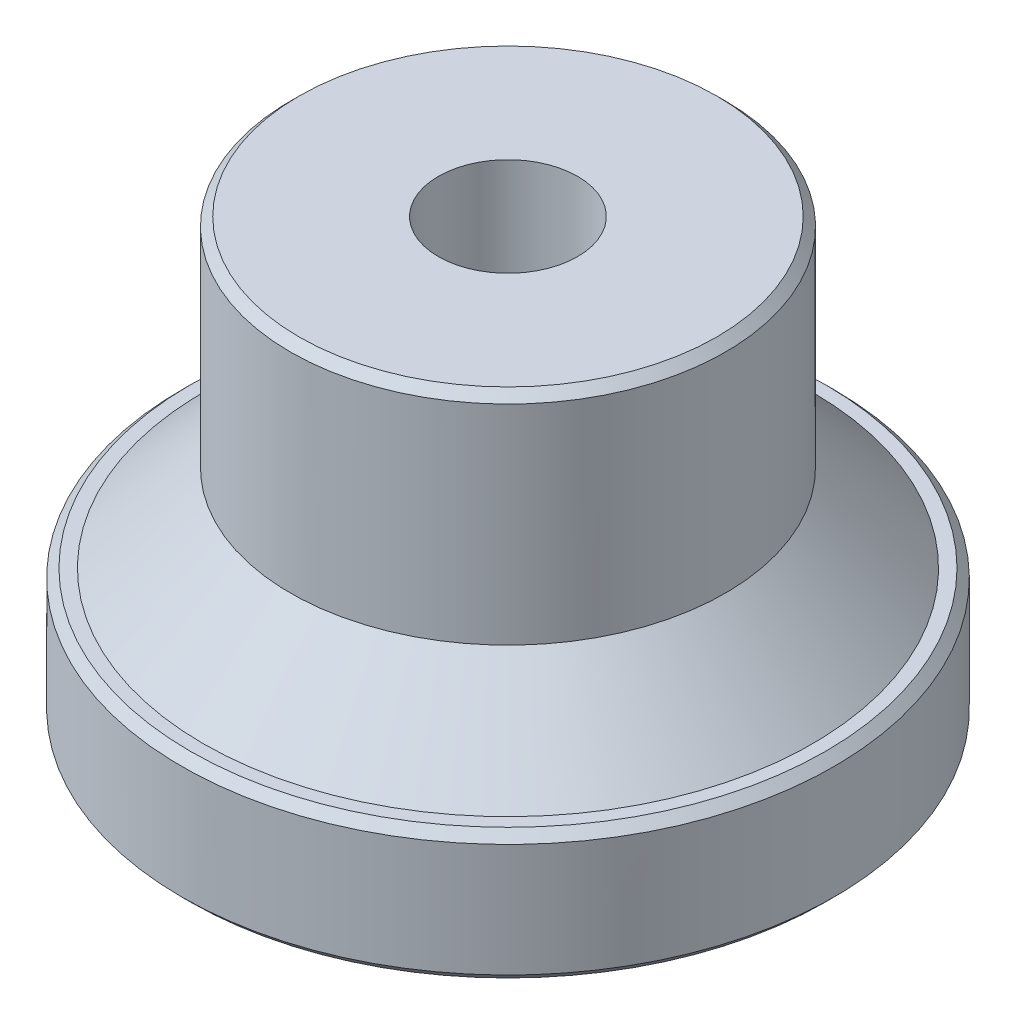
from build123d import *

# Parameters (mm, degrees)
SKETCH_1_R          = 5
SKETCH_1_R_2        = 1.6
EXTRUDE_1_DEPTH     = 10
SKETCH_2_R          = 3
CUT_EXTRUDE_1_DEPTH = 4
CHAMFER_1_SIZE      = 0.2
SKETCH_4_R          = 7.5
SKETCH_4_R_2        = 5
EXTRUDE_2_DEPTH     = 3
CHAMFER_2_SIZE      = 2
CHAMFER_3_SIZE      = 0.2


with BuildPart() as part:
    # ｽｹｯﾁ1 → ﾎﾞｽ - 押し出し1 (new body)
    with BuildSketch(Plane(origin=(0, 0, 0), x_dir=(1, 0, 0), z_dir=(0, 1, 0))):
        Circle(SKETCH_1_R)
        Circle(SKETCH_1_R_2, mode=Mode.SUBTRACT)
    extrude(amount=EXTRUDE_1_DEPTH)

    # ｽｹｯﾁ2 → ｶｯﾄ - 押し出し1 (cut)
    with BuildSketch(Plane.XZ):
        Circle(SKETCH_2_R)
    extrude(amount=-CUT_EXTRUDE_1_DEPTH, mode=Mode.SUBTRACT)

    # 面取り1
    chamfer_1_edges = [part.edges().sort_by_distance(p)[0] for p in [
        (-5, 10, 0),
    ]]
    chamfer(chamfer_1_edges, length=CHAMFER_1_SIZE)

    # ｽｹｯﾁ4 → ﾎﾞｽ - 押し出し2 (add)
    with BuildSketch(Plane.XZ):
        Circle(SKETCH_4_R)
        Circle(SKETCH_4_R_2, mode=Mode.SUBTRACT)
    extrude(amount=-EXTRUDE_2_DEPTH)

    # 面取り2
    chamfer_2_edges = [part.edges().sort_by_distance(p)[0] for p in [
        (-5, 3, 0),
    ]]
    chamfer(chamfer_2_edges, length=CHAMFER_2_SIZE)

    # 面取り3
    chamfer_3_edges = [part.edges().sort_by_distance(p)[0] for p in [
        (-7.5, 0, 0),
        (-7.5, 3, 0),
    ]]
    chamfer(chamfer_3_edges, length=CHAMFER_3_SIZE)


solid = part.part
